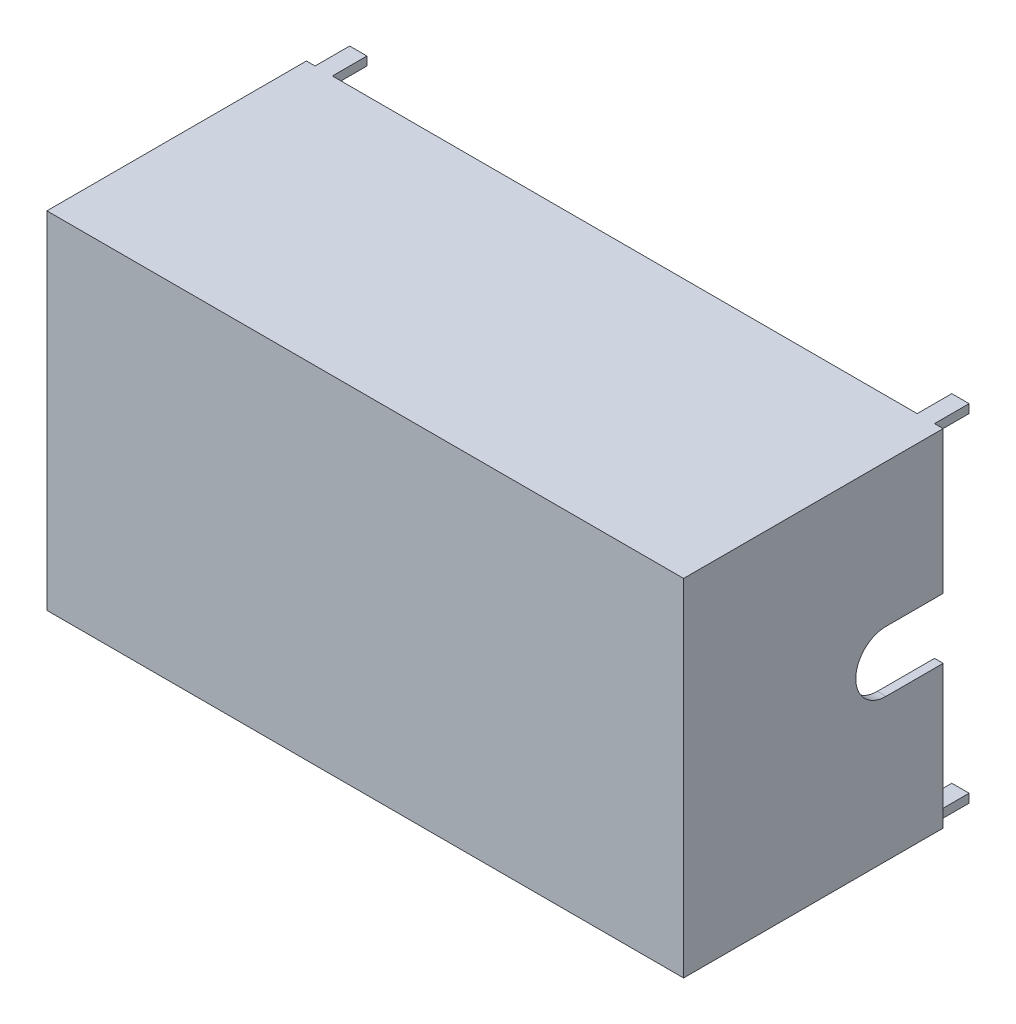
from build123d import *

# Parameters (mm, degrees)
ESQUISSE1_W             = 36.8
ESQUISSE1_H             = 20
ESQUISSE1_W_2           = 35.8
ESQUISSE1_H_2           = 19
BASE_EXTRUSION_DEPTH    = 14
ESQUISSE2_W             = 36.8
ESQUISSE2_H             = 20
BOSS_EXTRU_1_DEPTH      = 1
ENL_V_MAT_EXTRU_1_DEPTH = 43.872204303
ESQUISSE4_W             = 1
ESQUISSE4_H             = 0.5
BOSS_EXTRU_2_DEPTH      = 2


with BuildPart() as part:
    # Esquisse1 → Base-Extrusion (new body)
    with BuildSketch(Plane.XY):
        with Locations((-55.64228109, 6.086823856)):
            Rectangle(ESQUISSE1_W, ESQUISSE1_H)
        with Locations((-55.64228109, 6.086823856)):
            Rectangle(ESQUISSE1_W_2, ESQUISSE1_H_2, mode=Mode.SUBTRACT)
    extrude(amount=BASE_EXTRUSION_DEPTH)

    # Esquisse2 → Boss.-Extru.1 (add)
    with BuildSketch(Plane.XY.offset(14)):
        with Locations((-55.64228109, 6.086823856)):
            Rectangle(ESQUISSE2_W, ESQUISSE2_H)
    extrude(amount=BOSS_EXTRU_1_DEPTH)

    # Esquisse3 → Enlèv. mat.-Extru.1 (cut, through all)
    with BuildSketch(Plane(origin=(-37.24228109, 0, 0), x_dir=(0, 0, -1), z_dir=(1, 0, 0))):
        with BuildLine():
            Line((0.67598994, 7.836823856), (0.67598994, 4.336823856))
            Line((0.67598994, 4.336823856), (-3.3, 4.336823856))
            ThreePointArc((-3.3, 4.336823856), (-5.05, 6.086823856), (-3.3, 7.836823856))
            Line((-3.3, 7.836823856), (0.67598994, 7.836823856))
        make_face()
    extrude(amount=-ENL_V_MAT_EXTRU_1_DEPTH, mode=Mode.SUBTRACT)

    # Esquisse4 → Boss.-Extru.2 (add)
    with BuildSketch(Plane(origin=(0, 0, 0), x_dir=(-1, 0, 0), z_dir=(0, 0, -1))):
        with Locations((38.24228109, 15.836823856)):
            Rectangle(ESQUISSE4_W, ESQUISSE4_H)
        with Locations((73.04228109, 15.836823856)):
            Rectangle(ESQUISSE4_W, ESQUISSE4_H)
        with Locations((73.04228109, -3.663176144)):
            Rectangle(ESQUISSE4_W, ESQUISSE4_H)
        with Locations((38.24228109, -3.663176144)):
            Rectangle(ESQUISSE4_W, ESQUISSE4_H)
    extrude(amount=BOSS_EXTRU_2_DEPTH)


solid = part.part
